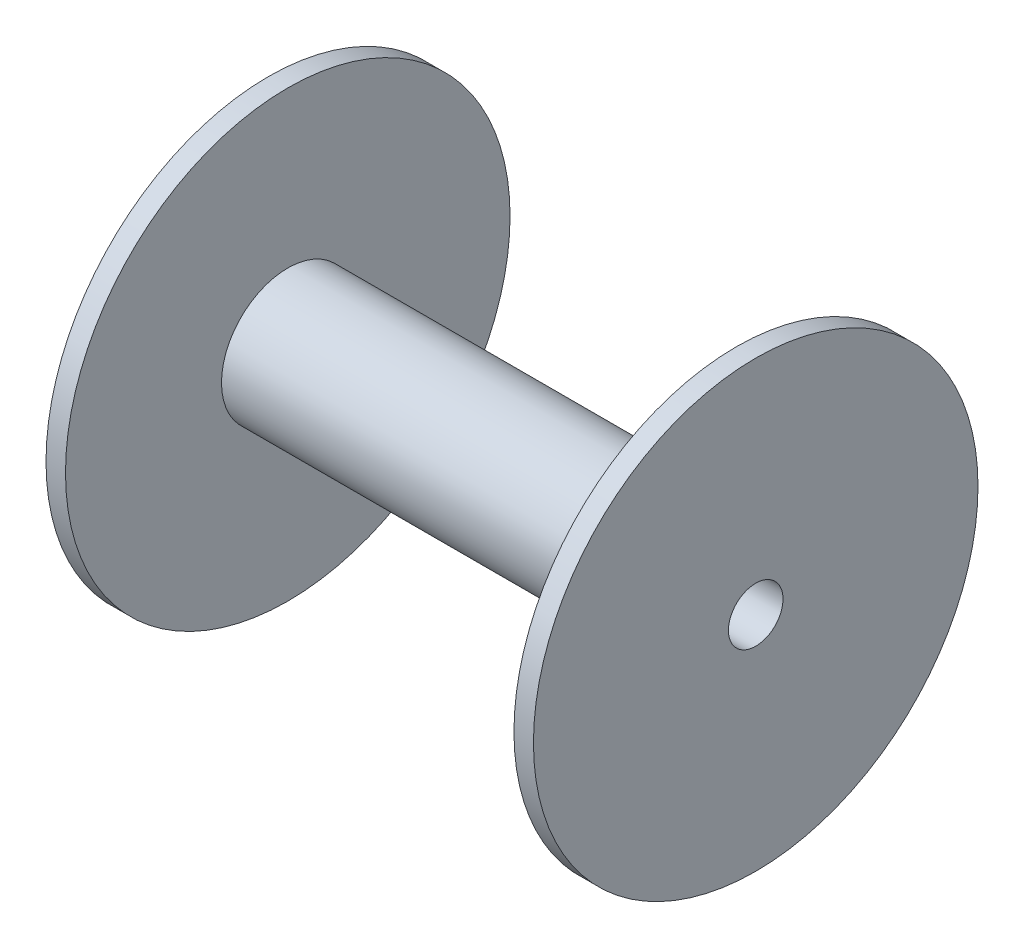
from build123d import *


with BuildPart() as part:
    # Sketch1 → Revolve1 (revolve)
    with BuildSketch(Plane.XY):
        Polygon((-62.5, 57), (-57.5, 57), (-57.5, 17), (57.5, 17), (57.5, 57), (62.5, 57), (62.5, 7), (-62.5, 7), align=None)
    revolve(axis=Axis((-75, 0, 0), (1, 0, 0)))


solid = part.part
